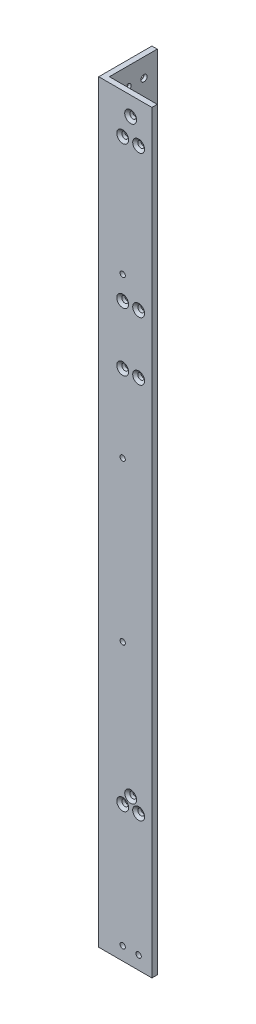
from build123d import *

# Parameters (mm, degrees)
BOSS_EXTRUDE1_DEPTH                               = 450
RIGHTSIDEHOLES_SKETCH3_R                          = 1.5875
RIGHTSIDEHOLES_CUT_EXTRUDE1_DEPTH                 = 3.175
FRONTSIDEHOLES_SKETCH4_R                          = 1.5875
FRONTSIDEHOLES_SKETCH4_R_2                        = 2
FRONTSIDEHOLES_CUT_EXTRUDE2_DEPTH                 = 3.175
CSK_FOR_6_FLAT_HEAD_MACHINE_SCREW_100_D           = 3.7973
CSK_FOR_6_FLAT_HEAD_MACHINE_SCREW_100_CSINK_D     = 7.0866
CSK_FOR_6_FLAT_HEAD_MACHINE_SCREW_100_CSINK_ANGLE = 100
CSK_FOR_6_FLAT_HEAD_MACHINE_SCREW_2_D             = 3.7973
CSK_FOR_6_FLAT_HEAD_MACHINE_SCREW_2_CSINK_D       = 7.0866
CSK_FOR_6_FLAT_HEAD_MACHINE_SCREW_2_CSINK_ANGLE   = 100


with BuildPart() as part:
    # Sketch2 → Boss-Extrude1 (new body)
    with BuildSketch(Plane(origin=(0, 0, 0), x_dir=(1, 0, 0), z_dir=(0, 1, 0))):
        Polygon((0, 31.75), (3.175, 31.75), (3.175, 3.175), (31.75, 3.175), (31.75, 0), (0, 0), align=None)
    extrude(amount=BOSS_EXTRUDE1_DEPTH)

    # RightSideHoles-Sketch3 → RightSideHoles-Cut-Extrude1 (cut)
    with BuildSketch(Plane.XY):
        with Locations((14.2875, 81.1125)):
            Circle(RIGHTSIDEHOLES_SKETCH3_R)
        with Locations((23.8125, 81.1125)):
            Circle(RIGHTSIDEHOLES_SKETCH3_R)
        with Locations((19.05, 87.4625)):
            Circle(RIGHTSIDEHOLES_SKETCH3_R)
        with Locations((14.2875, 426.1875)):
            Circle(RIGHTSIDEHOLES_SKETCH3_R)
        with Locations((19.05, 438.8875)):
            Circle(RIGHTSIDEHOLES_SKETCH3_R)
        with Locations((23.8125, 426.1875)):
            Circle(RIGHTSIDEHOLES_SKETCH3_R)
        with Locations((14.2875, 341.24737)):
            Circle(RIGHTSIDEHOLES_SKETCH3_R)
        with Locations((23.8125, 341.24737)):
            Circle(RIGHTSIDEHOLES_SKETCH3_R)
        with Locations((14.2875, 306.32237)):
            Circle(RIGHTSIDEHOLES_SKETCH3_R)
        with Locations((23.8125, 306.32237)):
            Circle(RIGHTSIDEHOLES_SKETCH3_R)
        with Locations((14.2875, 7.9375)):
            Circle(RIGHTSIDEHOLES_SKETCH3_R)
        with Locations((23.8125, 7.9375)):
            Circle(RIGHTSIDEHOLES_SKETCH3_R)
        with Locations((14.2875, 165)):
            Circle(RIGHTSIDEHOLES_SKETCH3_R)
        with Locations((14.2875, 260)):
            Circle(RIGHTSIDEHOLES_SKETCH3_R)
        with Locations((14.2875, 355)):
            Circle(RIGHTSIDEHOLES_SKETCH3_R)
    extrude(amount=-RIGHTSIDEHOLES_CUT_EXTRUDE1_DEPTH, mode=Mode.SUBTRACT)

    # FrontSideHoles-Sketch4 → FrontSideHoles-Cut-Extrude2 (cut)
    with BuildSketch(Plane.ZY):
        with Locations((-19.05, 81.1125)):
            Circle(FRONTSIDEHOLES_SKETCH4_R)
        with Locations((-23.8125, 87.4625)):
            Circle(FRONTSIDEHOLES_SKETCH4_R)
        with Locations((-14.2875, 87.4625)):
            Circle(FRONTSIDEHOLES_SKETCH4_R)
        with Locations((-23.8125, 438.8875)):
            Circle(FRONTSIDEHOLES_SKETCH4_R)
        with Locations((-14.2875, 438.8875)):
            Circle(FRONTSIDEHOLES_SKETCH4_R)
        with Locations((-19.05, 426.1875)):
            Circle(FRONTSIDEHOLES_SKETCH4_R)
        with Locations((-14.2875, 354.18487)):
            Circle(FRONTSIDEHOLES_SKETCH4_R_2)
        with Locations((-14.2875, 313.98487)):
            Circle(FRONTSIDEHOLES_SKETCH4_R_2)
        with Locations((-14.2875, 165)):
            Circle(FRONTSIDEHOLES_SKETCH4_R)
        with Locations((-14.2875, 260)):
            Circle(FRONTSIDEHOLES_SKETCH4_R)
        with Locations((-23.8125, 7.9375)):
            Circle(FRONTSIDEHOLES_SKETCH4_R)
        with Locations((-14.2875, 7.9375)):
            Circle(FRONTSIDEHOLES_SKETCH4_R)
    extrude(amount=-FRONTSIDEHOLES_CUT_EXTRUDE2_DEPTH, mode=Mode.SUBTRACT)

    # CSK for _6 Flat Head Machine Screw _100 (through all)
    with Locations(Plane.ZY):
        with Locations((-23.8125, 438.8875), (-19.05, 426.1875), (-14.2875, 438.8875), (-19.05, 81.1125), (-14.2875, 87.4625), (-23.8125, 87.4625)):
            CounterSinkHole(CSK_FOR_6_FLAT_HEAD_MACHINE_SCREW_100_D / 2, CSK_FOR_6_FLAT_HEAD_MACHINE_SCREW_100_CSINK_D / 2, counter_sink_angle=CSK_FOR_6_FLAT_HEAD_MACHINE_SCREW_100_CSINK_ANGLE)

    # CSK for _6 Flat Head Machine Screw _ 2 (through all)
    with Locations(Plane.XY):
        with Locations((14.2875, 81.1125), (19.05, 87.4625), (23.8125, 81.1125), (14.2875, 306.32237), (23.8125, 306.32237), (14.2875, 341.24737), (23.8125, 341.24737), (14.2875, 426.1875), (23.8125, 426.1875), (19.05, 438.8875)):
            CounterSinkHole(CSK_FOR_6_FLAT_HEAD_MACHINE_SCREW_2_D / 2, CSK_FOR_6_FLAT_HEAD_MACHINE_SCREW_2_CSINK_D / 2, counter_sink_angle=CSK_FOR_6_FLAT_HEAD_MACHINE_SCREW_2_CSINK_ANGLE)


solid = part.part
